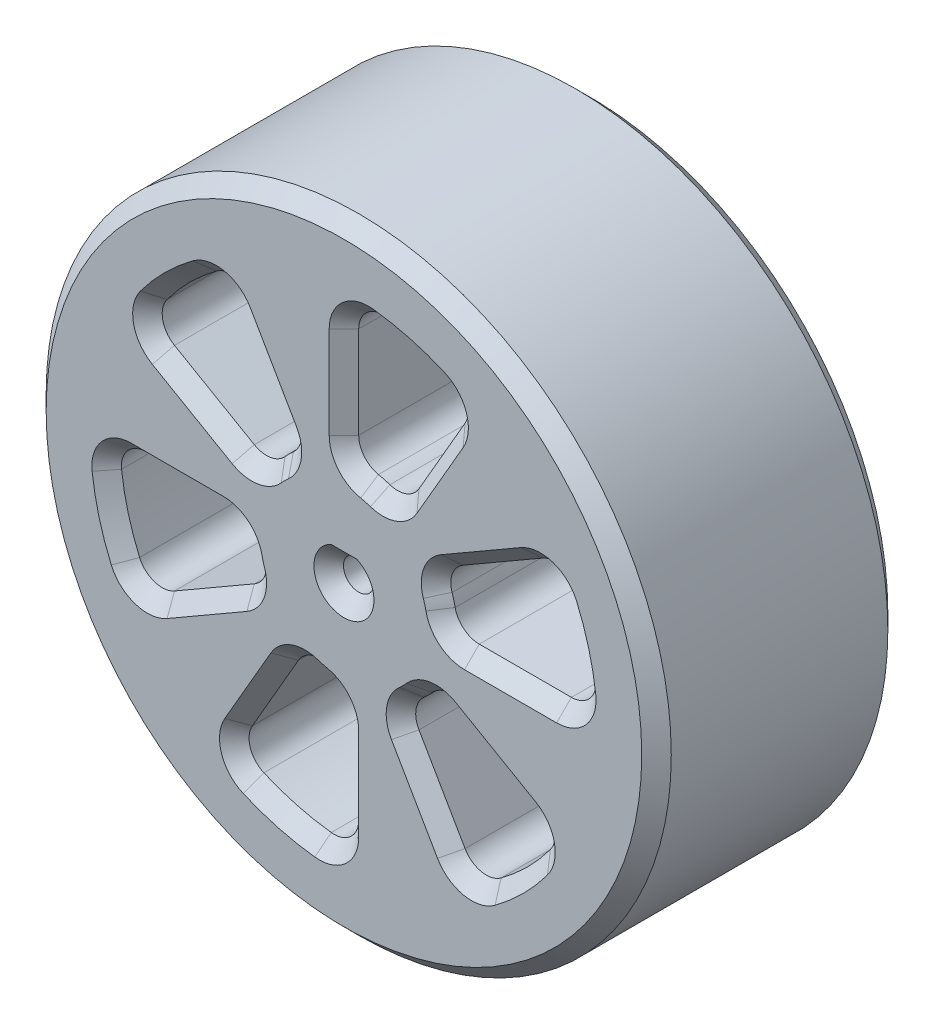
from build123d import *

# Parameters (mm, degrees)
SKETCH1_R           = 63.5
BOSS_EXTRUDE1_DEPTH = 50
CUT_EXTRUDE1_DEPTH  = 103.78375358
CIRPATTERN1_COUNT   = 6
FILLET1_R           = 5
CUT_EXTRUDE2_DEPTH  = 103.78375358
CHAMFER1_SIZE       = 3


with BuildPart() as part:
    # Sketch1 → Boss-Extrude1 (new body)
    with BuildSketch(Plane.XY):
        Circle(SKETCH1_R)
    extrude(amount=BOSS_EXTRUDE1_DEPTH)

    # Sketch2 → Cut-Extrude1 (cut, through all)
    with BuildSketch(Plane.XY.offset(50)):
        with BuildLine():
            Line((0, 48.5), (0, 20))
            ThreePointArc((0, 20), (5.176380902, 19.318516526), (10, 17.320508076))
            Line((10, 17.320508076), (24.25, 42.002232084))
            ThreePointArc((24.25, 42.002232084), (12.552723687, 46.847402575), (0, 48.5))
        make_face()
    cut_extrude1 = extrude(amount=-CUT_EXTRUDE1_DEPTH, mode=Mode.SUBTRACT)

    # CirPattern1: Cut-Extrude1 ×6 about axis
    cirpattern1_axis = Axis((0, 0, 50), (0, 0, -1))
    for i in range(1, CIRPATTERN1_COUNT):
        add(cut_extrude1.rotate(cirpattern1_axis, i * 360 / CIRPATTERN1_COUNT), mode=Mode.SUBTRACT)

    # Fillet1
    fillet1_edges = [part.edges().sort_by_distance(p)[0] for p in [
        (0, 48.5, 25),
        (24.25, 42.002232084, 25),
        (10, 17.320508076, 25),
        (-17.320508076, 10, 25),
        (-42.002232084, 24.25, 25),
        (-24.25, 42.002232084, 25),
        (-10, 17.320508076, 25),
        (0, -20, 25),
        (0, -48.5, 25),
        (-24.25, -42.002232084, 25),
        (-10, -17.320508076, 25),
        (-17.320508076, -10, 25),
        (-42.002232084, -24.25, 25),
        (-48.5, 0, 25),
        (-20, 0, 25),
        (17.320508076, -10, 25),
        (42.002232084, -24.25, 25),
        (24.25, -42.002232084, 25),
        (10, -17.320508076, 25),
        (17.320508076, 10, 25),
        (42.002232084, 24.25, 25),
        (48.5, 0, 25),
        (20, 0, 25),
        (0, 20, 25),
    ]]
    fillet(fillet1_edges, radius=FILLET1_R)

    # Sketch3 → Cut-Extrude2 (cut, through all)
    with BuildSketch(Plane.XY.offset(50)):
        with BuildLine():
            Line((1.833030278, 2.5), (-1.833030278, 2.5))
            ThreePointArc((-1.833030278, 2.5), (-1.401357581, -2.76517575), (3.1, 0))
            ThreePointArc((3.1, 0), (2.76517575, 1.401357581), (1.833030278, 2.5))
        make_face()
    extrude(amount=-CUT_EXTRUDE2_DEPTH, mode=Mode.SUBTRACT)

    # Chamfer1
    chamfer1_edges = [part.edges().sort_by_distance(p)[0] for p in [
        (-63.5, 0, 50),
        (22.022840236, 41.492394881, 50),
        (12.552723687, 46.847402575, 50),
        (1.673858333, 46.944888149, 50),
        (0, 33.853292831, 50),
        (1.127016654, 21.332619768, 50),
        (5.176380902, 19.318516526, 50),
        (9.690284831, 19.038098975, 50),
        (16.926646415, 29.317811593, 50),
        (-24.922047913, 39.818536549, 50),
        (-34.294678888, 34.294678888, 50),
        (-39.818536549, 24.922047913, 50),
        (-29.317811593, 16.926646415, 50),
        (-17.911082321, 11.642334937, 50),
        (-14.142135624, 14.142135624, 50),
        (-11.642334937, 17.911082321, 50),
        (-16.926646415, 29.317811593, 50),
        (-22.022840236, -41.492394881, 50),
        (-12.552723687, -46.847402575, 50),
        (-1.673858333, -46.944888149, 50),
        (0, -33.853292831, 50),
        (-1.127016654, -21.332619768, 50),
        (-5.176380902, -19.318516526, 50),
        (-9.690284831, -19.038098975, 50),
        (-16.926646415, -29.317811593, 50),
        (-46.944888149, -1.673858333, 50),
        (-46.847402575, -12.552723687, 50),
        (-41.492394881, -22.022840236, 50),
        (-29.317811593, -16.926646415, 50),
        (-19.038098975, -9.690284831, 50),
        (-19.318516526, -5.176380902, 50),
        (-21.332619768, -1.127016654, 50),
        (-33.853292831, 0, 50),
        (24.922047913, -39.818536549, 50),
        (34.294678888, -34.294678888, 50),
        (39.818536549, -24.922047913, 50),
        (29.317811593, -16.926646415, 50),
        (17.911082321, -11.642334937, 50),
        (14.142135624, -14.142135624, 50),
        (11.642334937, -17.911082321, 50),
        (16.926646415, -29.317811593, 50),
        (46.944888149, 1.673858333, 50),
        (46.847402575, 12.552723687, 50),
        (41.492394881, 22.022840236, 50),
        (29.317811593, 16.926646415, 50),
        (19.038098975, 9.690284831, 50),
        (19.318516526, 5.176380902, 50),
        (21.332619768, 1.127016654, 50),
        (33.853292831, 0, 50),
        (0, 2.5, 50),
        (0, -3.1, 50),
        (-63.5, 0, 0),
        (1.127016654, 21.332619768, 0),
        (0, 33.853292831, 0),
        (1.673858333, 46.944888149, 0),
        (12.552723687, 46.847402575, 0),
        (22.022840236, 41.492394881, 0),
        (16.926646415, 29.317811593, 0),
        (9.690284831, 19.038098975, 0),
        (5.176380902, 19.318516526, 0),
        (-17.911082321, 11.642334937, 0),
        (-29.317811593, 16.926646415, 0),
        (-39.818536549, 24.922047913, 0),
        (-34.294678888, 34.294678888, 0),
        (-24.922047913, 39.818536549, 0),
        (-16.926646415, 29.317811593, 0),
        (-11.642334937, 17.911082321, 0),
        (-14.142135624, 14.142135624, 0),
        (-1.127016654, -21.332619768, 0),
        (0, -33.853292831, 0),
        (-1.673858333, -46.944888149, 0),
        (-12.552723687, -46.847402575, 0),
        (-22.022840236, -41.492394881, 0),
        (-16.926646415, -29.317811593, 0),
        (-9.690284831, -19.038098975, 0),
        (-5.176380902, -19.318516526, 0),
        (-19.038098975, -9.690284831, 0),
        (-29.317811593, -16.926646415, 0),
        (-41.492394881, -22.022840236, 0),
        (-46.847402575, -12.552723687, 0),
        (-46.944888149, -1.673858333, 0),
        (-33.853292831, 0, 0),
        (-21.332619768, -1.127016654, 0),
        (-19.318516526, -5.176380902, 0),
        (17.911082321, -11.642334937, 0),
        (29.317811593, -16.926646415, 0),
        (39.818536549, -24.922047913, 0),
        (34.294678888, -34.294678888, 0),
        (24.922047913, -39.818536549, 0),
        (16.926646415, -29.317811593, 0),
        (11.642334937, -17.911082321, 0),
        (14.142135624, -14.142135624, 0),
        (19.038098975, 9.690284831, 0),
        (29.317811593, 16.926646415, 0),
        (41.492394881, 22.022840236, 0),
        (46.847402575, 12.552723687, 0),
        (46.944888149, 1.673858333, 0),
        (33.853292831, 0, 0),
        (21.332619768, 1.127016654, 0),
        (19.318516526, 5.176380902, 0),
        (0, -3.1, 0),
        (0, 2.5, 0),
    ]]
    chamfer(chamfer1_edges, length=CHAMFER1_SIZE)


solid = part.part
